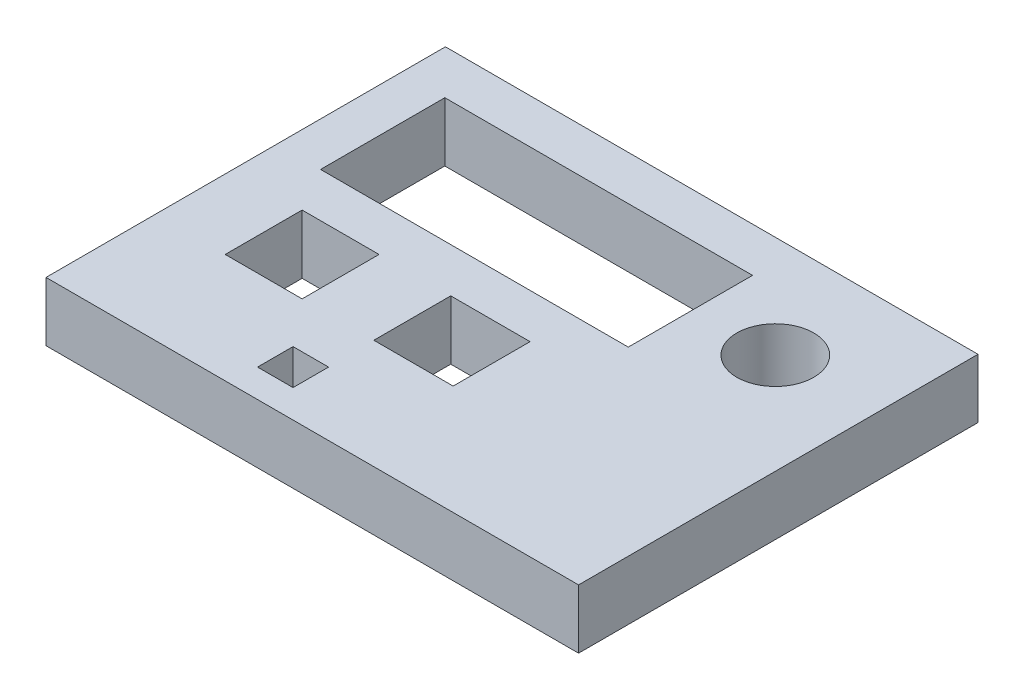
from build123d import *

# Parameters (mm, degrees)
SKETCH1_W           = 13
SKETCH1_H           = 13
SKETCH1_W_2         = 13.406613497
SKETCH1_W_3         = 52
SKETCH1_H_2         = 21
SKETCH1_R           = 6.5
BOSS_EXTRUDE1_DEPTH = 10


with BuildPart() as part:
    # Sketch1 → Boss-Extrude1 (new body)
    with BuildSketch(Plane(origin=(0, 0, 0), x_dir=(1, 0, 0), z_dir=(0, 1, 0))):
        Polygon((-45, 33.75), (-45, -33.75), (-11, -33.75), (45, -33.75), (45, 33.75), align=None)
        Polygon((-8, -29), (-11, -29), (-14, -29), (-14, -23), (-8, -23), align=None, mode=Mode.SUBTRACT)
        with Locations((-26.716961343, -8.75)):
            Rectangle(SKETCH1_W, SKETCH1_H, mode=Mode.SUBTRACT)
        with Locations((-1.396693251, -8.75)):
            Rectangle(SKETCH1_W_2, SKETCH1_H, mode=Mode.SUBTRACT)
        with Locations((-11.6, 15.75)):
            Rectangle(SKETCH1_W_3, SKETCH1_H_2, mode=Mode.SUBTRACT)
        with Locations((28, 16.5)):
            Circle(SKETCH1_R, mode=Mode.SUBTRACT)
    extrude(amount=BOSS_EXTRUDE1_DEPTH)


solid = part.part
